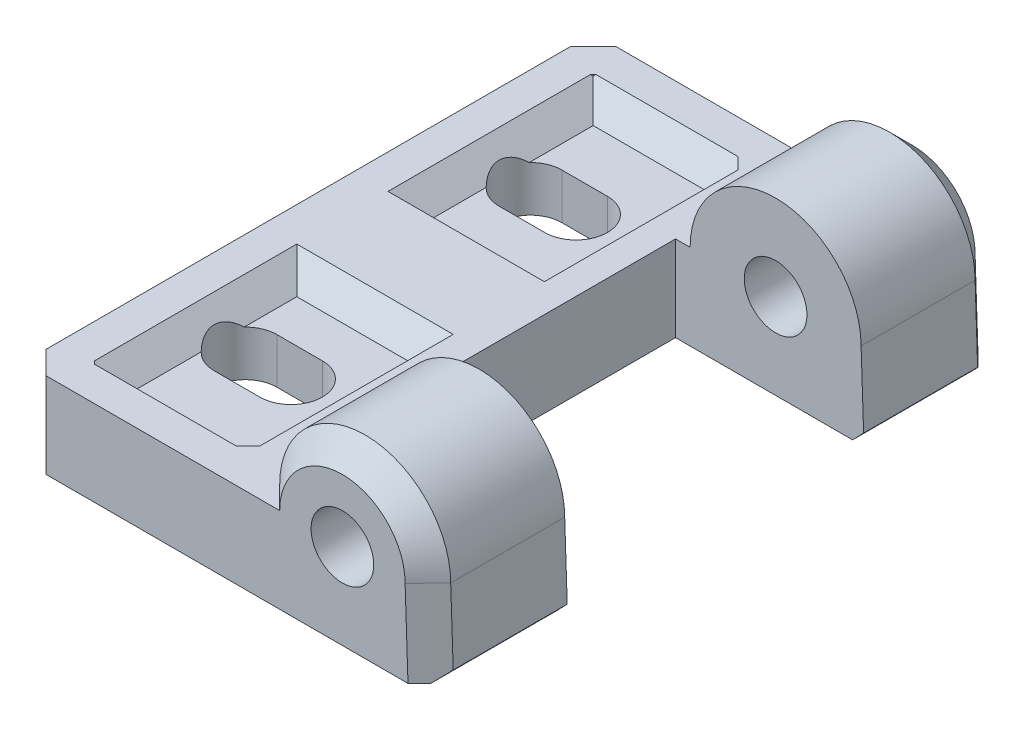
from build123d import *

# Parameters (mm, degrees)
BOSS_EXTRUDE1_DEPTH = 25
MOUNT_HOLES_DEPTH   = 41.422765863
SKETCH7_W           = 16.5
SKETCH7_H           = 26
CUT_PART_DEPTH      = 20
AXIS_R              = 2.75
CUT_EXTRUDE3_DEPTH  = 30
CUT_EXTRUDE4_DEPTH  = 1.5
CUT_EXTRUDE5_DEPTH  = 2
CHAMFER2_SIZE       = 2


with BuildPart() as part:
    # contour → Boss-Extrude1 (new, symmetric)
    with BuildSketch(Plane.XY):
        with BuildLine():
            Line((7.5, 0), (7.721344931, -6.500579199))
            Line((7.721344931, -6.500579199), (6.755375242, -7.5))
            Line((6.755375242, -7.5), (0, -7.5))
            Line((0, -7.5), (-28, -7.5))
            Line((-28, -7.5), (-28, -7.827e-05))
            Line((-28, -7.827e-05), (-7.5, -7.827e-05))
            ThreePointArc((-7.5, -7.827e-05), (-3.9135e-05, 7.5), (7.5, 0))
        make_face()
    extrude(amount=BOSS_EXTRUDE1_DEPTH, both=True)

    # Sketch6 → mount-holes (cut, through all)
    with BuildSketch(Plane.XZ.offset(7.5)):
        with BuildLine():
            Line((-21, 15.25), (-17, 15.25))
            ThreePointArc((-17, 15.25), (-14.25, 12.5), (-17, 9.75))
            Line((-17, 9.75), (-21, 9.75))
            ThreePointArc((-21, 9.75), (-23.75, 12.5), (-21, 15.25))
        make_face()
        with BuildLine():
            Line((-21, -9.75), (-17, -9.75))
            ThreePointArc((-17, -9.75), (-14.25, -12.5), (-17, -15.25))
            Line((-17, -15.25), (-21, -15.25))
            ThreePointArc((-21, -15.25), (-23.75, -12.5), (-21, -9.75))
        make_face()
    extrude(amount=-MOUNT_HOLES_DEPTH, mode=Mode.SUBTRACT)

    # Sketch7 → cut-part (cut)
    with BuildSketch(Plane.XZ.offset(7.5)):
        with Locations((-0.528655069, 0)):
            Rectangle(SKETCH7_W, SKETCH7_H)
    extrude(amount=-CUT_PART_DEPTH, mode=Mode.SUBTRACT)

    # axis → Cut-Extrude3 (cut, symmetric)
    with BuildSketch(Plane.XY):
        Circle(AXIS_R)
    extrude(amount=CUT_EXTRUDE3_DEPTH, both=True, mode=Mode.SUBTRACT)

    # Sketch9 → Cut-Extrude4 (cut)
    with BuildSketch(Plane.XZ.offset(7.5)):
        with BuildLine():
            Line((-17, 18.75), (-21, 18.75))
            ThreePointArc((-21, 18.75), (-27.25, 12.5), (-21, 6.25))
            Line((-21, 6.25), (-17, 6.25))
            ThreePointArc((-17, 6.25), (-10.75, 12.5), (-17, 18.75))
        make_face()
        with BuildLine():
            Line((-21, -18.75), (-17, -18.75))
            ThreePointArc((-17, -18.75), (-10.75, -12.5), (-17, -6.25))
            Line((-17, -6.25), (-21, -6.25))
            ThreePointArc((-21, -6.25), (-27.25, -12.5), (-21, -18.75))
        make_face()
    extrude(amount=-CUT_EXTRUDE4_DEPTH, mode=Mode.SUBTRACT)

    # Chamfer1
    # the kernel refuses this chamfer: 2 mm, written as the material it takes off along each edge
    with BuildSketch(Plane(origin=(7.324969659, 5.140386945, -25), x_dir=(0.027479951033163995, 0.0009356932186842305, 0.9996219169112968), z_dir=(0.03403031050568426, -0.9994208012478462, 0))) as chamfer1_piece_1_section:
        with BuildLine():
            Line((2.05734639, 0), (-0.11309431, 2.054235587))
            Line((-0.11309431, 2.054235587), (-0.153079186, 2.053135752))
            ThreePointArc((-0.153079186, 2.053135752), (-0.068258454, 1.026795659), (-0.039984877, -0.001099835))
            Line((-0.039984877, -0.001099835), (0.001099835, -0.039984877))
            ThreePointArc((0.001099835, -0.039984877), (1.028995329, -0.011711299), (2.058446225, -0.039984877))
            Line((2.058446225, -0.039984877), (2.05734639, 0))
        make_face()
    chamfer1_piece_1 = extrude(amount=16.79107846, mode=Mode.PRIVATE)
    chamfer1_piece_1 = split(chamfer1_piece_1, bisect_by=Plane(origin=(7.719880972, -6.502093854, -23.313005801), z_dir=(-0.7190376591339585, 0.6949711107284657, 0)), keep=Keep.TOP, mode=Mode.PRIVATE)
    add(chamfer1_piece_1, mode=Mode.SUBTRACT)
    with BuildSketch(Plane(origin=(7.324969659, 5.140386945, 25), x_dir=(-0.9990429371443961, -0.03401744422077874, 0.027495876610585647), z_dir=(0.03403031050568426, -0.9994208012478462, 0))) as chamfer1_piece_2_section:
        with BuildLine():
            Line((2.05734639, 0), (-0.11309431, 2.054235587))
            Line((-0.11309431, 2.054235587), (-0.153079186, 2.053135752))
            ThreePointArc((-0.153079186, 2.053135752), (-0.068258454, 1.026795659), (-0.039984877, -0.001099835))
            Line((-0.039984877, -0.001099835), (0.001099835, -0.039984877))
            ThreePointArc((0.001099835, -0.039984877), (1.028995329, -0.011711299), (2.058446225, -0.039984877))
            Line((2.058446225, -0.039984877), (2.05734639, 0))
        make_face()
    chamfer1_piece_2 = extrude(amount=16.79107846, mode=Mode.PRIVATE)
    chamfer1_piece_2 = split(chamfer1_piece_2, bisect_by=Plane(origin=(10.54505629, -3.579083939, 24.461957422), z_dir=(-0.7190376591339585, 0.6949711107284657, 0)), keep=Keep.TOP, mode=Mode.PRIVATE)
    add(chamfer1_piece_2, mode=Mode.SUBTRACT)
    with BuildSketch(Plane(origin=(-28, -7.5, -25), x_dir=(0.9996219169112968, 0, -0.027495876610585647), z_dir=(0, 1, 0)), Plane(origin=(-28, -7.5, 25), x_dir=(-0.027495876610585647, 0, -0.9996219169112968), z_dir=(0, 1, 0))) as chamfer1_piece_3:
        with BuildLine():
            Line((2.05734639, 0), (-0.11309431, -2.054235587))
            Line((-0.11309431, -2.054235587), (-0.153079186, -2.053135752))
            ThreePointArc((-0.153079186, -2.053135752), (-0.068258454, -1.026795659), (-0.039984877, 0.001099835))
            Line((-0.039984877, 0.001099835), (0.001099835, 0.039984877))
            ThreePointArc((0.001099835, 0.039984877), (1.028995329, 0.011711299), (2.058446225, 0.039984877))
            Line((2.058446225, 0.039984877), (2.05734639, 0))
        make_face()
    extrude(amount=7.49992173, mode=Mode.SUBTRACT)
    with BuildSketch(Plane(origin=(0, 0, -25), x_dir=(-0.7732184624570568, -0.6341397395807529, 0), z_dir=(0.6341397395807529, -0.7732184624570568, 0))) as chamfer1_piece_4_section:
        with BuildLine():
            Line((7.556568542, -2.056568542), (5.443431458, 0.056568542))
            Line((5.443431458, 0.056568542), (5.443431458, 0.096568542))
            ThreePointArc((5.443431458, 0.096568542), (6.471715729, 0.04), (7.5, 0.04))
            Line((7.5, 0.04), (7.54, 0))
            ThreePointArc((7.54, 0), (7.54, -1.028284271), (7.596568542, -2.056568542))
            Line((7.596568542, -2.056568542), (7.556568542, -2.056568542))
        make_face()
    chamfer1_piece_4 = revolve(axis=Axis((0, 0, -25), (0, 0, -1)), revolution_arc=258.711821509, mode=Mode.PRIVATE)
    chamfer1_piece_4 = split(chamfer1_piece_4, bisect_by=Plane(origin=(0, -7.827e-05, -24.025554596), z_dir=(0, 1, 0)), keep=Keep.TOP, mode=Mode.PRIVATE)
    chamfer1_piece_4 = split(chamfer1_piece_4, bisect_by=Plane(origin=(7.269376506, 6.773077101, -24.025554596), z_dir=(-0.9994208012478462, -0.03403031050568426, 0)), keep=Keep.TOP, mode=Mode.PRIVATE)
    add(chamfer1_piece_4, mode=Mode.SUBTRACT)
    with BuildSketch(Plane(origin=(0, 0, 25), x_dir=(-0.7732184624570568, -0.6341397395807529, 0), z_dir=(0.6341397395807529, -0.7732184624570568, 0))) as chamfer1_piece_5_section:
        with BuildLine():
            Line((5.443431458, -0.056568542), (7.556568542, 2.056568542))
            Line((7.556568542, 2.056568542), (7.596568542, 2.056568542))
            ThreePointArc((7.596568542, 2.056568542), (7.54, 1.028284271), (7.54, 0))
            Line((7.54, 0), (7.5, -0.04))
            ThreePointArc((7.5, -0.04), (6.471715729, -0.04), (5.443431458, -0.096568542))
            Line((5.443431458, -0.096568542), (5.443431458, -0.056568542))
        make_face()
    chamfer1_piece_5 = revolve(axis=Axis((0, 0, 25), (0, 0, -1)), revolution_arc=258.711821509, mode=Mode.PRIVATE)
    chamfer1_piece_5 = split(chamfer1_piece_5, bisect_by=Plane(origin=(0, -7.827e-05, 24.025554599), z_dir=(0, 1, 0)), keep=Keep.TOP, mode=Mode.PRIVATE)
    chamfer1_piece_5 = split(chamfer1_piece_5, bisect_by=Plane(origin=(7.269376506, 6.773077103, 24.025554599), z_dir=(-0.9994208012478462, -0.03403031050568426, 0)), keep=Keep.TOP, mode=Mode.PRIVATE)
    add(chamfer1_piece_5, mode=Mode.SUBTRACT)

    # Sketch10 → Cut-Extrude5 (cut)
    with BuildSketch(Plane(origin=(0, -7.827e-05, 0), x_dir=(1, 0, 0), z_dir=(0, 1, 0))):
        Polygon((-11.278655069, 4), (-25, 4), (-25, 21.757359313), (-24.757359313, 22), (-12.278655069, 22), (-11.278655069, 21), align=None)
        Polygon((-11.278655069, -4), (-25, -4), (-25, -21.757359313), (-24.757359313, -22), (-12.278655069, -22), (-11.278655069, -21), align=None)
    extrude(amount=-CUT_EXTRUDE5_DEPTH, mode=Mode.SUBTRACT)

    # Chamfer2
    # the kernel refuses this chamfer: 2 mm, written as the material it adds along each edge
    with BuildSketch(Plane(origin=(-29.900725289, -2.00007827, 22), x_dir=(0, 0.9996219169112968, 0.02749587661058563), z_dir=(1, 0, 0))) as chamfer2_piece_1_section:
        Polygon((CHAMFER2_SIZE * 0.999621916911, -CHAMFER2_SIZE * 0.0274958766106), (-CHAMFER2_SIZE * 0.0274958766106, -CHAMFER2_SIZE * 0.999621916911), (0, 0), align=None)
    chamfer2_piece_1 = extrude(amount=22.765436196, mode=Mode.PRIVATE)
    chamfer2_piece_1 = split(chamfer2_piece_1, bisect_by=Plane(origin=(-25, -1.339790295, 21.320575951), z_dir=(1, 0, 0)), keep=Keep.TOP, mode=Mode.PRIVATE)
    add(chamfer2_piece_1)
    with BuildSketch(Plane(origin=(-25, -2.00007827, 1.143365976), x_dir=(-0.02749587661058563, 0.9996219169112968, 0), z_dir=(0, 0, -1))) as chamfer2_piece_2_section:
        Polygon((CHAMFER2_SIZE * 0.999621916911, CHAMFER2_SIZE * 0.0274958766106), (-CHAMFER2_SIZE * 0.0274958766106, CHAMFER2_SIZE * 0.999621916911), (0, 0), align=None)
    chamfer2_piece_2 = extrude(amount=28.044091265, mode=Mode.PRIVATE)
    chamfer2_piece_2 = split(chamfer2_piece_2, bisect_by=Plane(origin=(-24.347473985, -1.326341277, -22), z_dir=(0, 0, 1)), keep=Keep.TOP, mode=Mode.PRIVATE)
    chamfer2_piece_2 = chamfer2_piece_2 - Plane(origin=(-21, -1.326341277, -12.5), x_dir=(0, 0, -1), z_dir=(0, -1, 0)) * Cylinder(2.75, 65, mode=Mode.PRIVATE)
    add(chamfer2_piece_2)
    with BuildSketch(Plane(origin=(-29.900725289, -2.00007827, -22), x_dir=(1.7831818563715163e-15, 0.9996219169112968, -0.02749587661058563), z_dir=(1, 0, 0))) as chamfer2_piece_3_section:
        Polygon((CHAMFER2_SIZE * 0.999621916911, CHAMFER2_SIZE * 0.0274958766106), (-CHAMFER2_SIZE * 0.0274958766106, CHAMFER2_SIZE * 0.999621916911), (0, 0), align=None)
    chamfer2_piece_3 = extrude(amount=22.765436196, mode=Mode.PRIVATE)
    chamfer2_piece_3 = split(chamfer2_piece_3, bisect_by=Plane(origin=(-21.883009307, -1.339790295, -24.874350006), z_dir=(0.7071067811864957, 0, 0.7071067811865993)), keep=Keep.TOP, mode=Mode.PRIVATE)
    add(chamfer2_piece_3)
    with BuildSketch(Plane(origin=(-11.278655069, -2.00007827, -26.143365976), x_dir=(0.027495876610586494, 0.9996219169112968, 0), z_dir=(0, 0, 1))) as chamfer2_piece_4_section:
        Polygon((CHAMFER2_SIZE * 0.999621916911, CHAMFER2_SIZE * 0.0274958766106), (-CHAMFER2_SIZE * 0.0274958766106, CHAMFER2_SIZE * 0.999621916911), (0, 0), align=None)
    chamfer2_piece_4 = extrude(amount=27.286731952, mode=Mode.PRIVATE)
    chamfer2_piece_4 = split(chamfer2_piece_4, bisect_by=Plane(origin=(-7.513844642, -1.337755995, -17.235189573), z_dir=(-0.707106781186572, 0, 0.707106781186523)), keep=Keep.TOP, mode=Mode.PRIVATE)
    add(chamfer2_piece_4)
    with BuildSketch(Plane(origin=(-11.278655069, -2.00007827, -4), x_dir=(0, 0.9996219169112968, 0.027495876610586275), z_dir=(-1, 0, 0))) as chamfer2_piece_5:
        Polygon((CHAMFER2_SIZE * 0.999621916911, CHAMFER2_SIZE * 0.0274958766106), (-CHAMFER2_SIZE * 0.0274958766106, CHAMFER2_SIZE * 0.999621916911), (0, 0), align=None)
    extrude(amount=13.721344931)
    with BuildSketch(Plane(origin=(-25, -2.00007827, -1.143365976), x_dir=(-0.02749587661058563, 0.9996219169112968, 0), z_dir=(0, 0, 1))) as chamfer2_piece_6_section:
        Polygon((CHAMFER2_SIZE * 0.999621916911, -CHAMFER2_SIZE * 0.0274958766106), (-CHAMFER2_SIZE * 0.0274958766106, -CHAMFER2_SIZE * 0.999621916911), (0, 0), align=None)
    chamfer2_piece_6 = extrude(amount=28.044091265, mode=Mode.PRIVATE)
    chamfer2_piece_6 = split(chamfer2_piece_6, bisect_by=Plane(origin=(-29.055362029, -1.326341277, 17.701997284), z_dir=(0.7071067811865476, 0, -0.7071067811865476)), keep=Keep.TOP, mode=Mode.PRIVATE)
    chamfer2_piece_6 = chamfer2_piece_6 - Plane(origin=(-21, -1.326341277, 12.5), x_dir=(0, 0, -1), z_dir=(0, -1, 0)) * Cylinder(2.75, 65, mode=Mode.PRIVATE)
    add(chamfer2_piece_6)
    with BuildSketch(Plane(origin=(-11.278655069, -2.00007827, 4), x_dir=(0, 0.9996219169112968, -0.027495876610586275), z_dir=(-1, 0, 0))) as chamfer2_piece_7:
        Polygon((CHAMFER2_SIZE * 0.999621916911, -CHAMFER2_SIZE * 0.0274958766106), (-CHAMFER2_SIZE * 0.0274958766106, -CHAMFER2_SIZE * 0.999621916911), (0, 0), align=None)
    extrude(amount=13.721344931)
    with BuildSketch(Plane(origin=(-11.278655069, -2.00007827, 26.143365976), x_dir=(0.027495876610586494, 0.9996219169112968, 0), z_dir=(0, 0, -1))) as chamfer2_piece_8_section:
        Polygon((CHAMFER2_SIZE * 0.999621916911, -CHAMFER2_SIZE * 0.0274958766106), (-CHAMFER2_SIZE * 0.0274958766106, -CHAMFER2_SIZE * 0.999621916911), (0, 0), align=None)
    chamfer2_piece_8 = extrude(amount=27.286731952, mode=Mode.PRIVATE)
    chamfer2_piece_8 = split(chamfer2_piece_8, bisect_by=Plane(origin=(-11.954010519, -1.337755995, 22), z_dir=(0, 0, -1)), keep=Keep.TOP, mode=Mode.PRIVATE)
    add(chamfer2_piece_8)


solid = part.part
